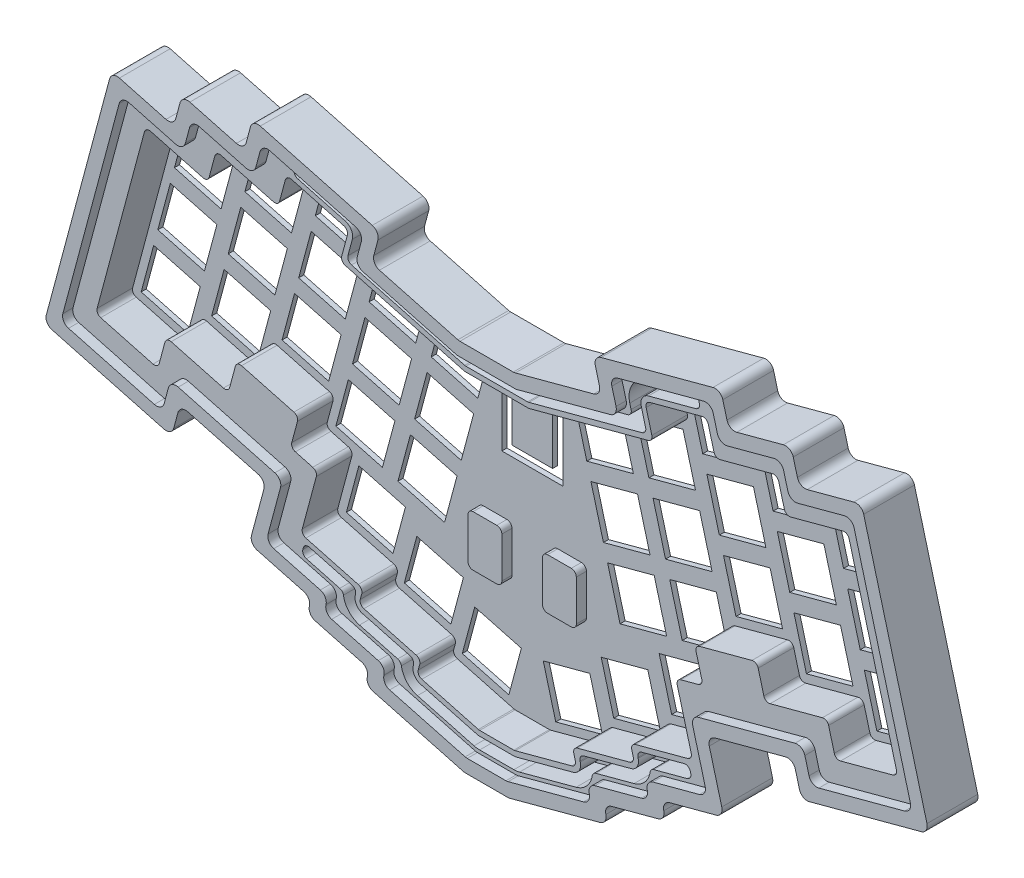
from build123d import *

# Parameters (mm, degrees)
BOSS_EXTRUDE1_DEPTH      = 1.5
CUT_EXTRUDE4_DEPTH       = 162.540110631
CUT_EXTRUDE1_DEPTH       = 147.628833045
CUT_EXTRUDE6_DEPTH       = 147.628833045
BOSS_EXTRUDE3_DEPTH      = 1.5
BOSS_EXTRUDE2_DEPTH      = 13.5
BOSS_EXTRUDE2_DEPTH_BACK = 1.5
CUT_EXTRUDE7_DEPTH       = 3
FILLET1_R                = 2.375
FILLET5_R                = 1.5
CUT_EXTRUDE13_DEPTH      = 10.5
FILLET6_R                = 1.5
CUT_EXTRUDE2_DEPTH       = 165.929397614
CUT_EXTRUDE2_DEPTH_BACK  = 165.929397614
SKETCH30_W               = 10
SKETCH30_H               = 15
BOSS_EXTRUDE4_DEPTH      = 3
FILLET3_R                = 1.5


with BuildPart() as part:
    # Sketch9 → Boss-Extrude1 (new body)
    with BuildSketch(Plane.XY):
        Polygon((-9.5, 0), (-119.615544197, 29.505371142), (-134.368229768, -25.552400957), (-52.928608539, -47.374081697), (-57.846170396, -65.726672396), (-39.493579696, -70.644234253), (-40.72297016, -75.232381928), (-22.370379461, -80.149943785), (-23.599769925, -84.73809146), (-5.247179226, -89.655653317), (5.247179226, -89.655653317), (23.599769925, -84.73809146), (22.370379461, -80.149943785), (40.72297016, -75.232381928), (39.493579696, -70.644234253), (57.846170396, -65.726672396), (52.928608539, -47.374081697), (134.368229768, -25.552400957), (119.615544197, 29.505371142), (9.5, 0), align=None)
        Polygon((-117.936165592, 26.596602072), (-121.624336984, 12.832159048), (-107.85989396, 9.143987655), (-104.171722567, 22.908430679), align=None, mode=Mode.SUBTRACT)
        Polygon((-99.583574892, 21.679040215), (-85.819131868, 17.990868822), (-89.50730326, 4.226425798), (-103.271746285, 7.914597191), align=None, mode=Mode.SUBTRACT)
        Polygon((-81.230984193, 16.761478358), (-67.466541168, 13.073306966), (-71.154712561, -0.691136059), (-84.919155585, 2.997035334), align=None, mode=Mode.SUBTRACT)
        Polygon((-62.878393493, 11.843916501), (-49.113950469, 8.155745109), (-52.802121861, -5.608697916), (-66.566564886, -1.920526523), align=None, mode=Mode.SUBTRACT)
        Polygon((-44.525802794, 6.926354644), (-30.761359769, 3.238183252), (-34.449531162, -10.526259773), (-48.213974186, -6.83808838), align=None, mode=Mode.SUBTRACT)
        Polygon((-26.173212094, 2.008792787), (-12.40876907, -1.679378605), (-16.096940462, -15.44382163), (-29.861383487, -11.755650237), align=None, mode=Mode.SUBTRACT)
        Polygon((-104.501136749, 3.326449516), (-90.736693724, -0.361721877), (-94.424865117, -14.126164902), (-108.189308142, -10.437993509), align=None, mode=Mode.SUBTRACT)
        Polygon((-86.14854605, -1.591112341), (-72.384103025, -5.279283734), (-76.072274418, -19.043726759), (-89.836717442, -15.355555366), align=None, mode=Mode.SUBTRACT)
        Polygon((-67.79595535, -6.508674198), (-54.031512325, -10.196845591), (-57.719683718, -23.961288616), (-71.484126743, -20.273117223), align=None, mode=Mode.SUBTRACT)
        Polygon((-49.443364651, -11.426236055), (-35.678921626, -15.114407448), (-39.367093019, -28.878850472), (-53.131536043, -25.19067908), align=None, mode=Mode.SUBTRACT)
        Polygon((-31.090773951, -16.343797912), (-17.326330927, -20.031969305), (-21.014502319, -33.796412329), (-34.778945344, -30.108240937), align=None, mode=Mode.SUBTRACT)
        Polygon((-109.418698606, -15.026141184), (-95.654255581, -18.714312577), (-99.342426974, -32.478755601), (-113.106869999, -28.790584208), align=None, mode=Mode.SUBTRACT)
        Polygon((-91.066107907, -19.943703041), (-77.301664882, -23.631874433), (-80.989836275, -37.396317458), (-94.754279299, -33.708146065), align=None, mode=Mode.SUBTRACT)
        Polygon((-72.713517207, -24.861264898), (-58.949074182, -28.54943629), (-62.637245575, -42.313879315), (-76.4016886, -38.625707922), align=None, mode=Mode.SUBTRACT)
        Polygon((-54.360926508, -29.778826755), (-40.596483483, -33.466998147), (-44.284654876, -47.231441172), (-58.0490979, -43.543269779), align=None, mode=Mode.SUBTRACT)
        Polygon((-36.008335808, -34.696388612), (-22.243892783, -38.384560004), (-25.932064176, -52.149003029), (-39.696507201, -48.460831636), align=None, mode=Mode.SUBTRACT)
        Polygon((-122.853727449, 8.244011373), (-109.089284424, 4.55583998), (-112.777455817, -9.208603045), (-126.541898841, -5.520431652), align=None, mode=Mode.SUBTRACT)
        Polygon((-127.771289306, -10.108579327), (-114.006846281, -13.79675072), (-117.695017674, -27.561193744), (-131.459460698, -23.873022351), align=None, mode=Mode.SUBTRACT)
        Polygon((-51.249229933, -50.282850767), (-37.484786909, -53.971022159), (-41.172958302, -67.735465184), (-54.937401326, -64.047293791), align=None, mode=Mode.SUBTRACT)
        Polygon((-17.002829463, -69.29426983), (-20.691000856, -83.058712855), (-6.926557831, -86.746884248), (-3.238386438, -72.982441223), align=None, mode=Mode.SUBTRACT)
        Polygon((-34.126029698, -59.788560298), (-37.814201091, -73.553003323), (-24.049758066, -77.241174716), (-20.361586674, -63.476731691), align=None, mode=Mode.SUBTRACT)
        Polygon((20.361586674, -63.476731691), (24.049758066, -77.241174716), (37.814201091, -73.553003323), (34.126029698, -59.788560298), align=None, mode=Mode.SUBTRACT)
        Polygon((3.238386438, -72.982441223), (17.002829463, -69.29426983), (20.691000856, -83.058712855), (6.926557831, -86.746884248), align=None, mode=Mode.SUBTRACT)
        Polygon((41.172958302, -67.735465184), (37.484786909, -53.971022159), (51.249229933, -50.282850767), (54.937401326, -64.047293791), align=None, mode=Mode.SUBTRACT)
        Polygon((127.771289306, -10.108579327), (131.459460698, -23.873022351), (117.695017674, -27.561193744), (114.006846281, -13.79675072), align=None, mode=Mode.SUBTRACT)
        Polygon((122.853727449, 8.244011373), (126.541898841, -5.520431652), (112.777455817, -9.208603045), (109.089284424, 4.55583998), align=None, mode=Mode.SUBTRACT)
        Polygon((36.008335808, -34.696388612), (39.696507201, -48.460831636), (25.932064176, -52.149003029), (22.243892783, -38.384560004), align=None, mode=Mode.SUBTRACT)
        Polygon((54.360926508, -29.778826755), (58.0490979, -43.543269779), (44.284654876, -47.231441172), (40.596483483, -33.466998147), align=None, mode=Mode.SUBTRACT)
        Polygon((72.713517207, -24.861264898), (76.4016886, -38.625707922), (62.637245575, -42.313879315), (58.949074182, -28.54943629), align=None, mode=Mode.SUBTRACT)
        Polygon((91.066107907, -19.943703041), (94.754279299, -33.708146065), (80.989836275, -37.396317458), (77.301664882, -23.631874433), align=None, mode=Mode.SUBTRACT)
        Polygon((109.418698606, -15.026141184), (113.106869999, -28.790584208), (99.342426974, -32.478755601), (95.654255581, -18.714312577), align=None, mode=Mode.SUBTRACT)
        Polygon((31.090773951, -16.343797912), (34.778945344, -30.108240937), (21.014502319, -33.796412329), (17.326330927, -20.031969305), align=None, mode=Mode.SUBTRACT)
        Polygon((49.443364651, -11.426236055), (53.131536043, -25.19067908), (39.367093019, -28.878850472), (35.678921626, -15.114407448), align=None, mode=Mode.SUBTRACT)
        Polygon((67.79595535, -6.508674198), (71.484126743, -20.273117223), (57.719683718, -23.961288616), (54.031512325, -10.196845591), align=None, mode=Mode.SUBTRACT)
        Polygon((86.14854605, -1.591112341), (89.836717442, -15.355555366), (76.072274418, -19.043726759), (72.384103025, -5.279283734), align=None, mode=Mode.SUBTRACT)
        Polygon((104.501136749, 3.326449516), (108.189308142, -10.437993509), (94.424865117, -14.126164902), (90.736693724, -0.361721877), align=None, mode=Mode.SUBTRACT)
        Polygon((26.173212094, 2.008792787), (29.861383487, -11.755650237), (16.096940462, -15.44382163), (12.40876907, -1.679378605), align=None, mode=Mode.SUBTRACT)
        Polygon((44.525802794, 6.926354644), (48.213974186, -6.83808838), (34.449531162, -10.526259773), (30.761359769, 3.238183252), align=None, mode=Mode.SUBTRACT)
        Polygon((62.878393493, 11.843916501), (66.566564886, -1.920526523), (52.802121861, -5.608697916), (49.113950469, 8.155745109), align=None, mode=Mode.SUBTRACT)
        Polygon((81.230984193, 16.761478358), (84.919155585, 2.997035334), (71.154712561, -0.691136059), (67.466541168, 13.073306966), align=None, mode=Mode.SUBTRACT)
        Polygon((99.583574892, 21.679040215), (103.271746285, 7.914597191), (89.50730326, 4.226425798), (85.819131868, 17.990868822), align=None, mode=Mode.SUBTRACT)
        Polygon((107.85989396, 9.143987655), (121.624336984, 12.832159048), (117.936165592, 26.596602072), (104.171722567, 22.908430679), align=None, mode=Mode.SUBTRACT)
    extrude(amount=BOSS_EXTRUDE1_DEPTH)

    # Sketch13 → Cut-Extrude4 (cut, through all)
    with BuildSketch(Plane.XY.offset(1.5)):
        Polygon((-119.615544197, 29.505371142), (-101.262953497, 24.587809285), (-116.015639068, -30.469962814), (-134.368229768, -25.552400957), align=None)
        Polygon((134.368229768, -25.552400957), (119.615544197, 29.505371142), (101.262953497, 24.587809285), (116.015639068, -30.469962814), align=None)
    extrude(amount=-CUT_EXTRUDE4_DEPTH, mode=Mode.SUBTRACT)

    # Sketch10 → Cut-Extrude1 (cut, through all)
    with BuildSketch(Plane.XY.offset(1.5)):
        Polygon((-9, -25.375), (9, -25.375), (9, -2.375), (6, -2.375), (6, -22.375), (-6, -22.375), (-6, -2.375), (-9, -2.375), align=None)
    extrude(amount=-CUT_EXTRUDE1_DEPTH, mode=Mode.SUBTRACT)

    # Sketch16 → Cut-Extrude6 (cut, through all)
    # profile 1 of 4: a face of its own
    with BuildSketch(Plane.XY.offset(1.5)):
        Polygon((-64.557772098, 14.752685571), (-46.205181399, 9.835123714), (-60.95786697, -45.222648385), (-79.310457669, -40.305086528), align=None)
        Polygon((-62.878393493, 11.843916501), (-49.113950469, 8.155745109), (-52.802121861, -5.608697916), (-66.566564886, -1.920526523), align=None, mode=Mode.SUBTRACT)
        Polygon((-54.031512325, -10.196845591), (-57.719683718, -23.961288616), (-71.484126743, -20.273117223), (-67.79595535, -6.508674198), align=None, mode=Mode.SUBTRACT)
        Polygon((-58.949074182, -28.54943629), (-62.637245575, -42.313879315), (-76.4016886, -38.625707922), (-72.713517207, -24.861264898), align=None, mode=Mode.SUBTRACT)
    # profile 2 of 4: a face of its own
    with BuildSketch(Plane.XY.offset(1.5)):
        Polygon((-101.262953497, 24.587809285), (-82.910362798, 19.670247428), (-97.663048369, -35.387524671), (-116.015639068, -30.469962814), align=None)
    # profile 3 of 4: a face of its own
    with BuildSketch(Plane.XY.offset(1.5)):
        Polygon((116.015639068, -30.469962814), (101.262953497, 24.587809285), (82.910362798, 19.670247428), (97.663048369, -35.387524671), align=None)
    # profile 4 of 4: a face of its own
    with BuildSketch(Plane.XY.offset(1.5)):
        Polygon((79.310457669, -40.305086528), (64.557772098, 14.752685571), (46.205181399, 9.835123714), (60.95786697, -45.222648385), align=None)
        Polygon((72.713517207, -24.861264898), (58.949074182, -28.54943629), (62.637245575, -42.313879315), (76.4016886, -38.625707922), align=None, mode=Mode.SUBTRACT)
        Polygon((67.79595535, -6.508674198), (54.031512325, -10.196845591), (57.719683718, -23.961288616), (71.484126743, -20.273117223), align=None, mode=Mode.SUBTRACT)
        Polygon((66.566564886, -1.920526523), (62.878393493, 11.843916501), (49.113950469, 8.155745109), (52.802121861, -5.608697916), align=None, mode=Mode.SUBTRACT)
    extrude(amount=-CUT_EXTRUDE6_DEPTH, mode=Mode.SUBTRACT)


with BuildPart() as cut_extrude6_piece_1:
    # of the separate pieces the step leaves, piece 1, a body of its own (cut_extrude6_pieces)
    add(part.part.solids().sort_by_distance((-9.5, 0, 0))[0])



with BuildPart() as cut_extrude6_piece_2:
    # of the separate pieces the step leaves, piece 2, a body of its own (cut_extrude6_pieces)
    add(part.part.solids().sort_by_distance((-64.557772098, 14.752685571, 0))[0])


with BuildPart() as cut_extrude6_piece_3:
    # of the separate pieces the step leaves, piece 3, a body of its own (cut_extrude6_pieces)
    add(part.part.solids().sort_by_distance((82.910362798, 19.670247428, 0))[0])


with BuildPart() as cut_extrude6_piece_1_1:
    add(cut_extrude6_piece_1.part)

    add(cut_extrude6_piece_2.part)  # Boss-Extrude3 merges Cut-Extrude6 piece 2

    add(cut_extrude6_piece_3.part)  # Boss-Extrude3 merges Cut-Extrude6 piece 3
    # Sketch17 → Boss-Extrude3 (add)
    # profile 1 of 4: a face of its own
    with BuildSketch(Plane.XY):
        Polygon((-64.557772098, 14.752685571), (-76.851676741, -31.128791178), (-58.499086041, -36.046353035), (-46.205181399, 9.835123714), (-43.746400471, 19.011419064), (-62.09899117, 23.928980921), align=None)
        Polygon((-60.419612565, 21.020211851), (-46.65516954, 17.332040458), (-50.343340933, 3.567597434), (-64.107783957, 7.255768826), align=None, mode=Mode.SUBTRACT)
        Polygon((-65.337174422, 2.667621152), (-51.572731397, -1.020550241), (-55.26090279, -14.784993266), (-69.025345814, -11.096821873), align=None, mode=Mode.SUBTRACT)
        Polygon((-70.254736279, -15.684969548), (-56.490293254, -19.373140941), (-60.178464647, -33.137583965), (-73.942907671, -29.449412573), align=None, mode=Mode.SUBTRACT)
    # profile 2 of 4: a face of its own
    with BuildSketch(Plane.XY):
        Polygon((-85.369143726, 10.493952078), (-103.721734426, 15.411513935), (-118.474419997, -39.646258163), (-100.121829297, -44.56382002), (-97.663048369, -35.387524671), align=None)
        Polygon((-102.042355821, 12.502744865), (-88.277912796, 8.814573473), (-91.966084189, -4.949869552), (-105.730527213, -1.261698159), align=None, mode=Mode.SUBTRACT)
        Polygon((-106.959917678, -5.849845834), (-93.195474653, -9.538017227), (-96.883646046, -23.302460251), (-110.64808907, -19.614288859), align=None, mode=Mode.SUBTRACT)
        Polygon((-111.877479535, -24.202436534), (-98.11303651, -27.890607926), (-101.801207903, -41.655050951), (-115.565650927, -37.966879558), align=None, mode=Mode.SUBTRACT)
    # profile 3 of 4: a face of its own
    with BuildSketch(Plane.XY):
        Polygon((85.369143726, 10.493952078), (97.663048369, -35.387524671), (100.121829297, -44.56382002), (118.474419997, -39.646258163), (103.721734426, 15.411513935), align=None)
        Polygon((101.801207903, -41.655050951), (115.565650927, -37.966879558), (111.877479535, -24.202436534), (98.11303651, -27.890607926), align=None, mode=Mode.SUBTRACT)
        Polygon((96.883646046, -23.302460251), (110.64808907, -19.614288859), (106.959917678, -5.849845834), (93.195474653, -9.538017227), align=None, mode=Mode.SUBTRACT)
        Polygon((105.730527213, -1.261698159), (102.042355821, 12.502744865), (88.277912796, 8.814573473), (91.966084189, -4.949869552), align=None, mode=Mode.SUBTRACT)
    # profile 4 of 4: a face of its own
    with BuildSketch(Plane.XY):
        Polygon((76.851676741, -31.128791178), (58.499086041, -36.046353035), (46.205181399, 9.835123714), (43.746400471, 19.011419064), (62.09899117, 23.928980921), (64.557772098, 14.752685571), align=None)
        Polygon((60.178464647, -33.137583965), (73.942907671, -29.449412573), (70.254736279, -15.684969548), (56.490293254, -19.373140941), align=None, mode=Mode.SUBTRACT)
        Polygon((55.26090279, -14.784993266), (69.025345814, -11.096821873), (65.337174422, 2.667621152), (51.572731397, -1.020550241), align=None, mode=Mode.SUBTRACT)
        Polygon((64.107783957, 7.255768826), (60.419612565, 21.020211851), (46.65516954, 17.332040458), (50.343340933, 3.567597434), align=None, mode=Mode.SUBTRACT)
    extrude(amount=BOSS_EXTRUDE3_DEPTH)

    # Sketch14 → Boss-Extrude2 (add, two sides: drawn at the far end of the back side and taken through both)
    with BuildSketch(Plane.XY.offset(1.5).offset(-BOSS_EXTRUDE2_DEPTH_BACK)):
        Polygon((-33.957732685, 16.906191526), (-31.498951757, 26.082486876), (-69.170058982, 36.176429635), (-71.62883991, 27.000134285), (-89.98143061, 31.917696142), (-92.440211538, 22.741400792), (-110.792802238, 27.658962649), (-130.721868711, -46.717325975), (-93.050761485, -56.811268734), (-90.591980557, -47.634973385), (-65.176057253, -54.445149509), (-70.09361911, -72.797740208), (-51.74102841, -77.715302065), (-52.970418874, -82.30344974), (-34.617828175, -87.221011597), (-35.847218639, -91.809159272), (-6.563704202, -99.655653317), (6.563704202, -99.655653317), (35.847218639, -91.809159272), (34.617828175, -87.221011597), (52.970418874, -82.30344974), (51.74102841, -77.715302065), (70.09361911, -72.797740208), (65.176057253, -54.445149509), (90.591980557, -47.634973385), (93.050761485, -56.811268734), (130.721868711, -46.717325975), (110.792802238, 27.658962649), (92.440211538, 22.741400792), (89.98143061, 31.917696142), (71.62883991, 27.000134285), (69.170058982, 36.176429635), (31.498951757, 26.082486876), (33.957732685, 16.906191526), (8.183475024, 10), (-8.183475024, 10), align=None)
        Polygon((-46.205181399, 9.835123714), (-43.746400471, 19.011419064), (-62.09899117, 23.928980921), (-64.557772098, 14.752685571), (-82.910362798, 19.670247428), (-85.369143726, 10.493952078), (-103.721734426, 15.411513935), (-118.474419997, -39.646258163), (-100.121829297, -44.56382002), (-97.663048369, -35.387524671), (-79.310457669, -40.305086528), (-76.851676741, -31.128791178), (-58.499086041, -36.046353035), (-60.95786697, -45.222648385), (-52.928608539, -47.374081697), (-57.846170396, -65.726672396), (-39.493579696, -70.644234253), (-40.72297016, -75.232381928), (-22.370379461, -80.149943785), (-23.599769925, -84.73809146), (-5.247179226, -89.655653317), (5.247179226, -89.655653317), (23.599769925, -84.73809146), (22.370379461, -80.149943785), (40.72297016, -75.232381928), (39.493579696, -70.644234253), (57.846170396, -65.726672396), (52.928608539, -47.374081697), (60.95786697, -45.222648385), (58.499086041, -36.046353035), (76.851676741, -31.128791178), (79.310457669, -40.305086528), (97.663048369, -35.387524671), (100.121829297, -44.56382002), (118.474419997, -39.646258163), (103.721734426, 15.411513935), (85.369143726, 10.493952078), (82.910362798, 19.670247428), (64.557772098, 14.752685571), (62.09899117, 23.928980921), (43.746400471, 19.011419064), (46.205181399, 9.835123714), (9.5, 0), (-9.5, 0), align=None, mode=Mode.SUBTRACT)
    extrude(amount=BOSS_EXTRUDE2_DEPTH + BOSS_EXTRUDE2_DEPTH_BACK)

    # Sketch18 → Cut-Extrude7 (cut)
    with BuildSketch(Plane.XY.offset(15)):
        Polygon((30.948239154, -88.980732147), (29.718848689, -84.392584472), (48.071439389, -79.475022615), (46.842048925, -74.886874941), (65.194639624, -69.969313084), (60.277077767, -51.616722384), (93.420407682, -42.735993899), (95.87918861, -51.912289249), (125.822889225, -43.888898851), (107.964375113, 22.759983163), (89.611784414, 17.842421306), (87.153003485, 27.018716656), (68.800412786, 22.101154799), (66.341631857, 31.277450149), (36.397931242, 23.254059751), (38.856712171, 14.077764401), (8.710085014, 6), (-8.710085014, 6), (-38.856712171, 14.077764401), (-36.397931242, 23.254059751), (-66.341631857, 31.277450149), (-68.800412786, 22.101154799), (-87.153003485, 27.018716656), (-89.611784414, 17.842421306), (-107.964375113, 22.759983163), (-125.822889225, -43.888898851), (-95.87918861, -51.912289249), (-93.420407682, -42.735993899), (-60.277077767, -51.616722384), (-65.194639624, -69.969313084), (-46.842048925, -74.886874941), (-48.071439389, -79.475022615), (-29.718848689, -84.392584472), (-30.948239154, -88.980732147), (-6.037094211, -95.655653317), (6.037094211, -95.655653317), align=None)
        Polygon((-79.310457669, -40.305086528), (-76.851676741, -31.128791178), (-58.499086041, -36.046353035), (-60.95786697, -45.222648385), (-52.928608539, -47.374081697), (-57.846170396, -65.726672396), (-39.493579696, -70.644234253), (-40.72297016, -75.232381928), (-22.370379461, -80.149943785), (-23.599769925, -84.73809146), (-5.247179226, -89.655653317), (5.247179226, -89.655653317), (23.599769925, -84.73809146), (22.370379461, -80.149943785), (40.72297016, -75.232381928), (39.493579696, -70.644234253), (57.846170396, -65.726672396), (52.928608539, -47.374081697), (60.95786697, -45.222648385), (58.499086041, -36.046353035), (76.851676741, -31.128791178), (79.310457669, -40.305086528), (97.663048369, -35.387524671), (100.121829297, -44.56382002), (118.474419997, -39.646258163), (103.721734426, 15.411513935), (85.369143726, 10.493952078), (82.910362798, 19.670247428), (64.557772098, 14.752685571), (62.09899117, 23.928980921), (43.746400471, 19.011419064), (46.205181399, 9.835123714), (9.5, 0), (-9.5, 0), (-46.205181399, 9.835123714), (-43.746400471, 19.011419064), (-62.09899117, 23.928980921), (-64.557772098, 14.752685571), (-82.910362798, 19.670247428), (-85.369143726, 10.493952078), (-103.721734426, 15.411513935), (-118.474419997, -39.646258163), (-100.121829297, -44.56382002), (-97.663048369, -35.387524671), align=None, mode=Mode.SUBTRACT)
    extrude(amount=-CUT_EXTRUDE7_DEPTH, mode=Mode.SUBTRACT)

    # Fillet1
    fillet1_edges = [cut_extrude6_piece_1_1.edges().sort_by_distance(p)[0] for p in [
        (-90.591980557, -47.634973385, 7.5),
        (-70.09361911, -72.797740208, 7.5),
        (-51.74102841, -77.715302065, 7.5),
        (-52.970418874, -82.30344974, 7.5),
        (-34.617828175, -87.221011597, 7.5),
        (-35.847218639, -91.809159272, 7.5),
        (6.563704202, -99.655653317, 7.5),
        (-6.563704202, -99.655653317, 7.5),
        (-6.037094211, -95.655653317, 13.5),
        (-30.948239154, -88.980732147, 13.5),
        (-29.718848689, -84.392584472, 13.5),
        (-48.071439389, -79.475022615, 13.5),
        (-46.842048925, -74.886874941, 13.5),
        (-65.194639624, -69.969313084, 13.5),
        (-93.420407682, -42.735993899, 13.5),
        (-95.87918861, -51.912289249, 13.5),
        (-125.822889225, -43.888898851, 13.5),
        (-107.964375113, 22.759983163, 13.5),
        (-89.611784414, 17.842421306, 13.5),
        (-87.153003485, 27.018716656, 13.5),
        (-68.800412786, 22.101154799, 13.5),
        (-66.341631857, 31.277450149, 13.5),
        (-36.397931242, 23.254059751, 13.5),
        (-38.856712171, 14.077764401, 13.5),
        (-8.710085014, 6, 13.5),
        (-33.957732685, 16.906191526, 7.5),
        (-8.183475024, 10, 7.5),
        (-31.498951757, 26.082486876, 7.5),
        (-69.170058982, 36.176429635, 7.5),
        (-71.62883991, 27.000134285, 7.5),
        (-89.98143061, 31.917696142, 7.5),
        (-92.440211538, 22.741400792, 7.5),
        (-110.792802238, 27.658962649, 7.5),
        (-130.721868711, -46.717325975, 7.5),
        (-93.050761485, -56.811268734, 7.5),
        (-65.176057253, -54.445149509, 7.5),
        (-60.277077767, -51.616722384, 13.5),
    ]]
    fillet(fillet1_edges, radius=FILLET1_R - 0.0001)  # a hair under: the kernel refuses the full size

    # Fillet5
    fillet5_edges = [cut_extrude6_piece_1_1.edges().sort_by_distance(p)[0] for p in [
        (-64.557772098, 14.752685571, 6.75),
        (-43.746400471, 19.011419064, 6.75),
        (-79.310457669, -40.305086528, 6.75),
        (-62.09899117, 23.928980921, 6.75),
        (-76.851676741, -31.128791178, 6.75),
        (-39.493579696, -70.644234253, 6.75),
        (-40.72297016, -75.232381928, 6.75),
        (-22.370379461, -80.149943785, 6.75),
        (-23.599769925, -84.73809146, 6.75),
        (-5.247179226, -89.655653317, 6.75),
        (-57.846170396, -65.726672396, 6.75),
        (-60.95786697, -45.222648385, 6.75),
        (-9.5, 0, 6.75),
        (-46.205181399, 9.835123714, 6.75),
        (-52.928608539, -47.374081697, 6.75),
        (-58.499086041, -36.046353035, 6.75),
        (-97.663048369, -35.387524671, 6.75),
        (-82.910362798, 19.670247428, 6.75),
        (-118.474419997, -39.646258163, 6.75),
        (-85.369143726, 10.493952078, 6.75),
        (-100.121829297, -44.56382002, 6.75),
        (-103.721734426, 15.411513935, 6.75),
    ]]
    fillet(fillet5_edges, radius=FILLET5_R)

    # Sketch42 → Cut-Extrude13 (cut)
    with BuildSketch(Plane.XY.offset(12)):
        with BuildLine():
            Line((60.804895944, 28.758610052), (37.622676114, 22.54695297))
            Line((37.622676114, 22.54695297), (40.081457042, 13.37065762))
            Line((40.081457042, 13.37065762), (8.841737512, 5))
            Line((8.841737512, 5), (-8.841737512, 5))
            Line((-8.841737512, 5), (-40.081457042, 13.37065762))
            Line((-40.081457042, 13.37065762), (-39.304999907, 16.268435099))
            ThreePointArc((-39.304999907, 16.268435099), (-39.954352653, 21.200758892), (-43.901193984, 24.229276763))
            Line((-43.901193984, 24.229276763), (-59.356007205, 28.370381484))
            Line((-59.356007205, 28.370381484), (-60.261873863, 24.989641092))
            Line((-60.261873863, 24.989641092), (-44.807060642, 20.848536371))
            ThreePointArc((-44.807060642, 20.848536371), (-42.985441566, 19.450758892), (-42.685740299, 17.174301757))
            Line((-42.685740299, 17.174301757), (-44.368064092, 10.895783886))
            Line((-44.368064092, 10.895783886), (-9.302521254, 1.5))
            Line((-9.302521254, 1.5), (9.302521254, 1.5))
            Line((9.302521254, 1.5), (44.368064092, 10.895783886))
            Line((44.368064092, 10.895783886), (41.909283163, 20.072079235))
            Line((41.909283163, 20.072079235), (61.710762602, 25.37786966))
            Line((61.710762602, 25.37786966), (60.804895944, 28.758610052))
        make_face()
        with BuildLine():
            Line((-57.691376882, -70.944530096), (-45.38547414, -74.241886797))
            ThreePointArc((-45.38547414, -74.241886797), (-44.021217255, -78.156446648), (-40.568176647, -80.450239627))
            Line((-40.568176647, -80.450239627), (-28.262273905, -83.747596329))
            ThreePointArc((-28.262273905, -83.747596329), (-26.89801702, -87.66215618), (-23.444976411, -89.955949159))
            Line((-23.444976411, -89.955949159), (-6.732024273, -94.434171188))
            ThreePointArc((-6.732024273, -94.434171188), (-5.898120729, -94.600044916), (-5.049700479, -94.655653317))
            Line((-5.049700479, -94.655653317), (5.905441714, -94.655653317))
            Line((5.905441714, -94.655653317), (29.723494282, -88.273625366))
            Line((29.723494282, -88.273625366), (28.494103818, -83.685477691))
            Line((28.494103818, -83.685477691), (46.846694517, -78.767915834))
            Line((46.846694517, -78.767915834), (45.617304053, -74.179768159))
            Line((45.617304053, -74.179768159), (59.140265621, -70.556301528))
            Line((59.140265621, -70.556301528), (58.234398963, -67.175561136))
            Line((58.234398963, -67.175561136), (41.330697003, -71.704894425))
            Line((41.330697003, -71.704894425), (42.560087468, -76.2930421))
            Line((42.560087468, -76.2930421), (24.207496768, -81.210603957))
            Line((24.207496768, -81.210603957), (25.436887232, -85.798751632))
            Line((25.436887232, -85.798751632), (5.444657972, -91.155653317))
            Line((5.444657972, -91.155653317), (-5.049700479, -91.155653317))
            ThreePointArc((-5.049700479, -91.155653317), (-5.441279056, -91.129987901), (-5.826157615, -91.053430796))
            Line((-5.826157615, -91.053430796), (-22.539109753, -86.575208767))
            ThreePointArc((-22.539109753, -86.575208767), (-24.36072883, -85.177431288), (-24.660430097, -82.900974153))
            Line((-24.660430097, -82.900974153), (-24.207496768, -81.210603957))
            Line((-24.207496768, -81.210603957), (-39.662309989, -77.069499235))
            ThreePointArc((-39.662309989, -77.069499235), (-41.483929065, -75.671721757), (-41.783630332, -73.395264621))
            Line((-41.783630332, -73.395264621), (-41.330697003, -71.704894425))
            Line((-41.330697003, -71.704894425), (-56.785510224, -67.563789704))
            Line((-56.785510224, -67.563789704), (-57.691376882, -70.944530096))
        make_face()
    extrude(amount=-CUT_EXTRUDE13_DEPTH, mode=Mode.SUBTRACT)

    # Fillet6
    fillet6_edges = [cut_extrude6_piece_1_1.edges().sort_by_distance(p)[0] for p in [
        (-8.841737512, 5, 6.75),
        (-40.081457042, 13.37065762, 6.75),
        (-59.356007205, 28.370381484, 6.75),
        (-60.261873863, 24.989641092, 6.75),
        (-44.368064092, 10.895783886, 6.75),
        (-9.302521254, 1.5, 6.75),
        (-45.38547414, -74.241886797, 6.75),
        (-28.262273905, -83.747596329, 6.75),
        (-24.207496768, -81.210603957, 6.75),
        (-41.330697003, -71.704894425, 6.75),
        (-56.785510224, -67.563789704, 6.75),
        (-57.691376882, -70.944530096, 6.75),
    ]]
    fillet(fillet6_edges, radius=FILLET6_R)

    # Sketch11 → Cut-Extrude2 (cut, two sides: drawn at the far end of the back side and taken through both)
    with BuildSketch(Plane.XY.offset(1.5).offset(-CUT_EXTRUDE2_DEPTH_BACK)):
        Polygon((0, 45.820752986), (0, -159.737346116), (300.693265972, -12.777821734), (105.822172512, 71.528112316), align=None)
    extrude(amount=CUT_EXTRUDE2_DEPTH + CUT_EXTRUDE2_DEPTH_BACK, mode=Mode.SUBTRACT)

    # Mirror1: Cut-Extrude6 piece 1 across plane


with BuildPart() as cut_extrude6_piece_1_2:
    add(cut_extrude6_piece_1_1.part)
    add(cut_extrude6_piece_1_1.part.mirror(Plane(origin=(0, 0, 0), x_dir=(0, 0, 1), z_dir=(1, 0, 0))))

    # Sketch30 → Boss-Extrude4 (add)
    with BuildSketch(Plane.XY.offset(1.5)):
        with Locations((-11, -49.655653317)):
            Rectangle(SKETCH30_W, SKETCH30_H)
        with Locations((11, -49.655653317)):
            Rectangle(SKETCH30_W, SKETCH30_H)
    extrude(amount=BOSS_EXTRUDE4_DEPTH)

    # Fillet3
    fillet3_edges = [cut_extrude6_piece_1_2.edges().sort_by_distance(p)[0] for p in [
        (-16, -42.155653317, 3),
        (-16, -57.155653317, 3),
        (-6, -57.155653317, 3),
        (-6, -42.155653317, 3),
        (16, -42.155653317, 3),
        (6, -42.155653317, 3),
        (6, -57.155653317, 3),
        (16, -57.155653317, 3),
    ]]
    fillet(fillet3_edges, radius=FILLET3_R)


solid = cut_extrude6_piece_1_2.part
